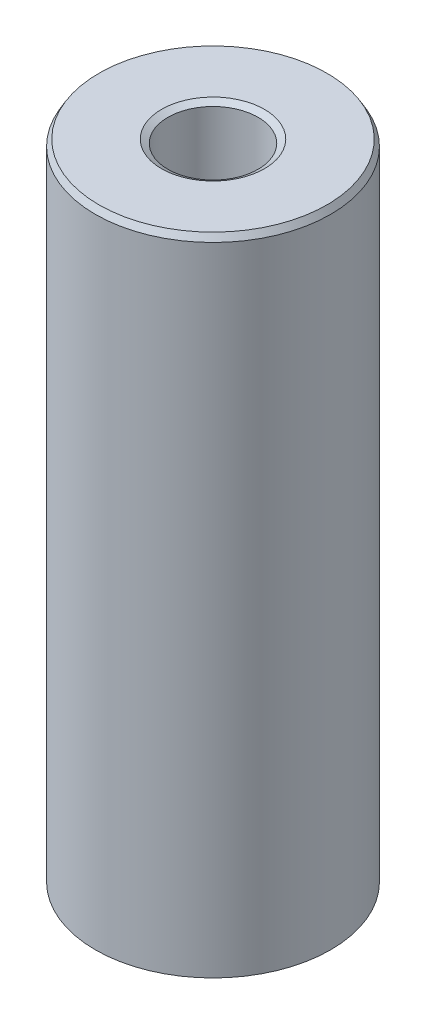
from build123d import *
from OCP.BRepFilletAPI import BRepFilletAPI_MakeChamfer

# Parameters (mm, degrees)
SKETCH1_R           = 40
BOSS_EXTRUDE1_DEPTH = 219.879496603
SKETCH2_R           = 15.324097091
CUT_EXTRUDE1_DEPTH  = 228.039628758
CHAMFER1_SIZE       = 2.164359064
CHAMFER1_SIZE2      = 1.249593288


with BuildPart() as part:
    # Sketch1 → Boss-Extrude1 (new body)
    with BuildSketch(Plane(origin=(0, 0, 0), x_dir=(1, 0, 0), z_dir=(0, 1, 0))):
        Circle(SKETCH1_R)
    extrude(amount=BOSS_EXTRUDE1_DEPTH)

    # Sketch2 → Cut-Extrude1 (cut, through all)
    with BuildSketch(Plane(origin=(0, 0, 0), x_dir=(1, 0, 0), z_dir=(0, 1, 0))):
        Circle(SKETCH2_R)
    extrude(amount=CUT_EXTRUDE1_DEPTH, mode=Mode.SUBTRACT)

    # Chamfer1: one chamfer whose edges measure the first distance from different faces: ONE call of the kernel's chamfer builder (chamfer() names one face for all edges)
    chamfer1_edges_1 = [part.edges().sort_by_distance(p)[0] for p in [
        (-15.324097091, 219.879496603, 0),
    ]]
    chamfer1_side_1 = [part.faces().sort_by_distance(p)[0] for p in [
        (-38.86862915, 219.879496603, 0),
    ]]
    chamfer1_edges_2 = [part.edges().sort_by_distance(p)[0] for p in [
        (-15.324097091, 0, 0),
    ]]
    chamfer1_side_2 = [part.faces().sort_by_distance(p)[0] for p in [
        (-15.324097091, 109.939748302, 0),
    ]]
    chamfer1_edges_3 = [part.edges().sort_by_distance(p)[0] for p in [
        (-40, 0, 0),
    ]]
    chamfer1_side_3 = [part.faces().sort_by_distance(p)[0] for p in [
        (-38.86862915, 0, 0),
    ]]
    chamfer1_edges_4 = [part.edges().sort_by_distance(p)[0] for p in [
        (-40, 219.879496603, 0),
    ]]
    chamfer1_side_4 = [part.faces().sort_by_distance(p)[0] for p in [
        (-40, 109.939748302, 0),
    ]]
    chamfer1 = BRepFilletAPI_MakeChamfer(part.part.solid().wrapped)
    for e in chamfer1_edges_1:
        chamfer1.Add(CHAMFER1_SIZE, CHAMFER1_SIZE2, e.wrapped, chamfer1_side_1[0].wrapped)  # the first distance lies on this face
    for e in chamfer1_edges_2:
        chamfer1.Add(CHAMFER1_SIZE, CHAMFER1_SIZE2, e.wrapped, chamfer1_side_2[0].wrapped)  # the first distance lies on this face
    for e in chamfer1_edges_3:
        chamfer1.Add(CHAMFER1_SIZE, CHAMFER1_SIZE2, e.wrapped, chamfer1_side_3[0].wrapped)  # the first distance lies on this face
    for e in chamfer1_edges_4:
        chamfer1.Add(CHAMFER1_SIZE, CHAMFER1_SIZE2, e.wrapped, chamfer1_side_4[0].wrapped)  # the first distance lies on this face
    add(Compound.cast(chamfer1.Shape()), mode=Mode.REPLACE)


solid = part.part
